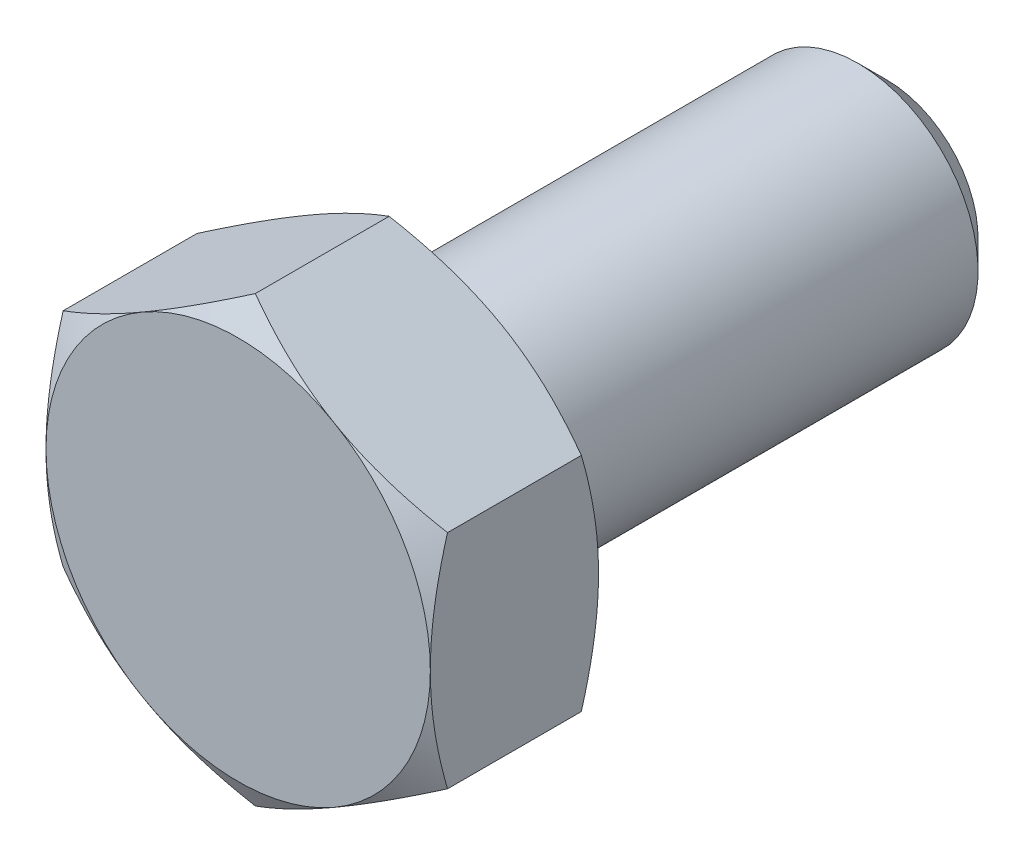
from build123d import *

# Parameters (mm, degrees)
BOSS_EXTRUDE1_DEPTH = 3.5
SKETCH16_OUTSIDE_W  = 57.702
SKETCH16_OUTSIDE_H  = 58.94
SKETCH16_OUTSIDE_R  = 4
CUT_EXTRUDE7_DEPTH  = 12.718930555
CUT_EXTRUDE7_DRAFT  = -60
CHAMFER1_SIZE       = 0.6


with BuildPart() as part:
    # Sketch1 → Revolve1 (revolve)
    with BuildSketch(Plane(origin=(0, 0, 0), x_dir=(0, 0, -1), z_dir=(1, 0, 0))):
        Polygon((3.5, 2.5), (13.5, 2.5), (13.5, 0), (0, 0), (0, 4), (3.5, 4), align=None)
    revolve(axis=Axis((0, 0, -13.5), (0, 0, 1)))

    # Sketch2 → Boss-Extrude1 (add)
    with BuildSketch(Plane.XY):
        Polygon((4, 2.309401077), (0, 4.618802154), (-4, 2.309401077), (-4, -2.309401077), (0, -4.618802154), (4, -2.309401077), align=None)
    extrude(amount=-BOSS_EXTRUDE1_DEPTH)

    # Cut-Extrude2: read off the stored shape, not the designer's step
    # Cut-Extrude2 outline → Cut-Extrude2 (revolve, cut)
    with BuildSketch(Plane.XZ):
        Polygon((4.618802154, 2.09e-07), (3.999999819, 2.09e-07), (4.618802154, -0.35726559), align=None)
    revolve(axis=Axis((0, 0, 0), (0, 0, 1)), mode=Mode.SUBTRACT)

    # Cut-Extrude2 2 outline → Cut-Extrude2 2 (revolve, cut)
    with BuildSketch(Plane.XZ):
        Polygon((4.618802154, 2.09e-07), (3.999999819, 2.09e-07), (4.618802154, -0.35726559), align=None)
    revolve(axis=Axis((0, 0, 0), (0, 0, 1)), mode=Mode.SUBTRACT)


with BuildPart() as cut_extrude7_tool:
    # Sketch16 outside → Cut-Extrude7 (with draft: the straight prism first)
    with BuildSketch(Plane(origin=(0, 0, -3.5), x_dir=(-1, 0, 0), z_dir=(0, 0, -1))):
        Rectangle(SKETCH16_OUTSIDE_W, SKETCH16_OUTSIDE_H)
        Circle(SKETCH16_OUTSIDE_R, mode=Mode.SUBTRACT)
    extrude(amount=-CUT_EXTRUDE7_DEPTH)
    # Cut-Extrude7: the draft: its side faces are tilted about the plane it starts from
    cut_extrude7_sides = [cut_extrude7_tool.faces().sort_by_distance(p)[0] for p in [
        (0, -29.47, 2.859465277),
        (-28.851, 0, 2.859465277),
        (0, 29.47, 2.859465277),
        (28.851, 0, 2.859465277),
        (4, 0, 2.859465277),
    ]]
    draft(cut_extrude7_sides, Plane(origin=(0, 0, -3.5), x_dir=(-1, 0, 0), z_dir=(0, 0, -1)), CUT_EXTRUDE7_DRAFT)


with BuildPart() as part_1:
    add(part.part)

    # Cut-Extrude7: cut by cut_extrude7_tool
    add(cut_extrude7_tool.part, mode=Mode.SUBTRACT)

    # Chamfer1
    chamfer1_edges = [part_1.edges().sort_by_distance(p)[0] for p in [
        (0, -2.5, -13.5),
    ]]
    chamfer(chamfer1_edges, length=CHAMFER1_SIZE)


solid = part_1.part
